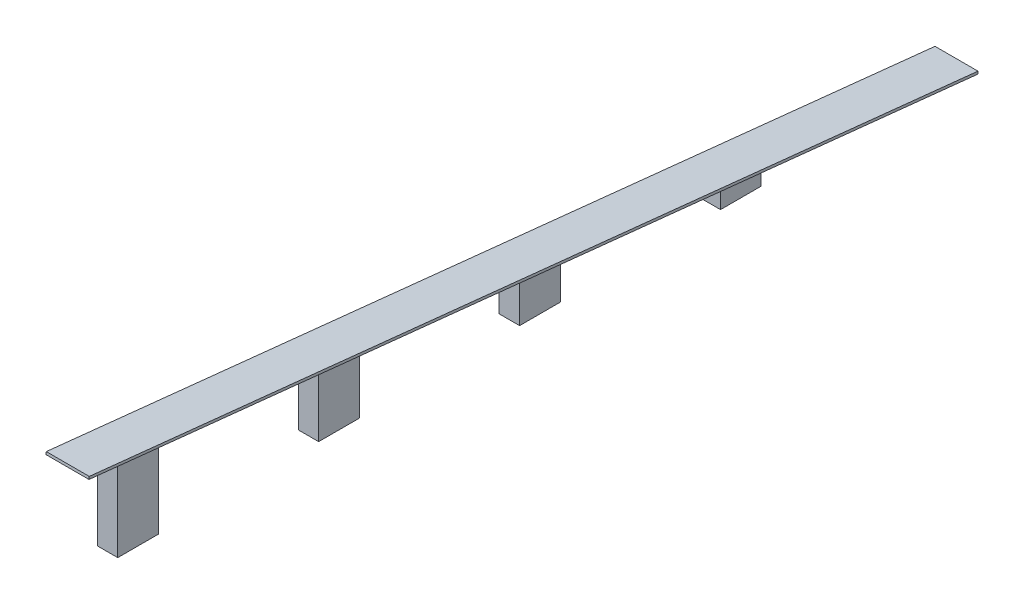
from build123d import *

# Parameters (mm, degrees)
SLOPE_THICKEN1_START  = 3.175
SLOPE_THICKEN1_DEPTH  = 53.65
BOSS_EXTRUDE1_DEPTH   = 12.7
BOSS_EXTRUDE1_2_DEPTH = 12.7
BOSS_EXTRUDE1_3_DEPTH = 12.7
BOSS_EXTRUDE1_4_DEPTH = 12.7


# Read off the part's stored shape, not the designer's step: <Slope>-<Thicken1>
with BuildPart() as part:
    # <Slope>-<Thicken1> outline → <Slope>-<Thicken1> (new body)
    with BuildSketch(Plane.YZ.offset(SLOPE_THICKEN1_START)):
        Polygon((-199.318851276, -1823.377908094), (-196.161244258, -1823.709785964), (-79.565459926, -714.375), (-82.723066944, -714.043122129), align=None)
    extrude(amount=SLOPE_THICKEN1_DEPTH)


with BuildPart() as body_2:
    # Sketch2 → Boss-Extrude1 (new, symmetric)
    with BuildSketch(Plane(origin=(30, 0, 0), x_dir=(0, 0, -1), z_dir=(1, 0, 0))):
        Polygon((764.043122129, -87.978278707), (764.043122129, -199.318851276), (814.843122129, -199.318851276), (814.843122129, -93.317573858), align=None)
    extrude(amount=BOSS_EXTRUDE1_DEPTH, both=True)


with BuildPart() as body_3:
    # Sketch2 → Boss-Extrude1 2 (new, symmetric)
    with BuildSketch(Plane(origin=(30, 0, 0), x_dir=(0, 0, -1), z_dir=(1, 0, 0))):
        Polygon((1065.643122129, -199.318851276), (1014.843122129, -199.318851276), (1014.843122129, -114.338420912), (1065.643122129, -119.677716063), align=None)
    extrude(amount=BOSS_EXTRUDE1_2_DEPTH, both=True)


with BuildPart() as body_4:
    # Sketch2 → Boss-Extrude1 3 (new, symmetric)
    with BuildSketch(Plane(origin=(30, 0, 0), x_dir=(0, 0, -1), z_dir=(1, 0, 0))):
        Polygon((1265.643122129, -140.698563116), (1316.443122129, -146.037858268), (1316.443122129, -199.318851276), (1265.643122129, -199.318851276), align=None)
    extrude(amount=BOSS_EXTRUDE1_3_DEPTH, both=True)


with BuildPart() as body_5:
    # Sketch2 → Boss-Extrude1 4 (new, symmetric)
    with BuildSketch(Plane(origin=(30, 0, 0), x_dir=(0, 0, -1), z_dir=(1, 0, 0))):
        Polygon((1516.443122129, -167.058705321), (1567.243122129, -172.398000472), (1567.243122129, -199.318851276), (1516.443122129, -199.318851276), align=None)
    extrude(amount=BOSS_EXTRUDE1_4_DEPTH, both=True)


solid = Compound([part.part, body_2.part, body_3.part, body_4.part, body_5.part])
